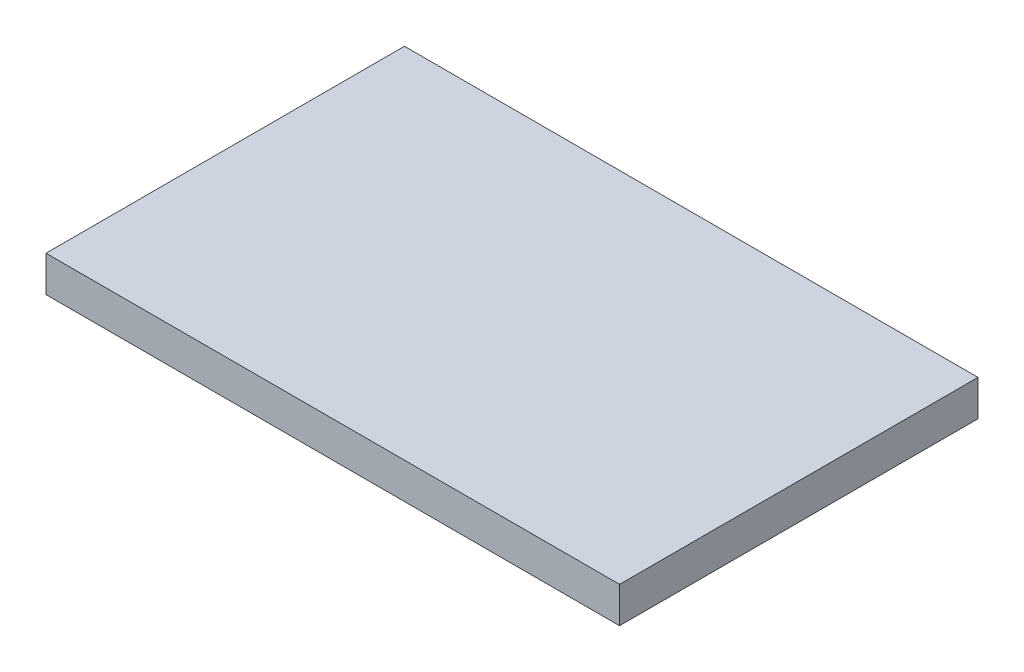
from build123d import *

# Parameters (mm, degrees)
SKETCH1_W           = 96
SKETCH1_H           = 60
BOSS_EXTRUDE1_DEPTH = 6


with BuildPart() as part:
    # Sketch1 → Boss-Extrude1 (new body)
    with BuildSketch(Plane(origin=(0, 0, 0), x_dir=(1, 0, 0), z_dir=(0, 1, 0))):
        Rectangle(SKETCH1_W, SKETCH1_H)
    extrude(amount=BOSS_EXTRUDE1_DEPTH)


solid = part.part
